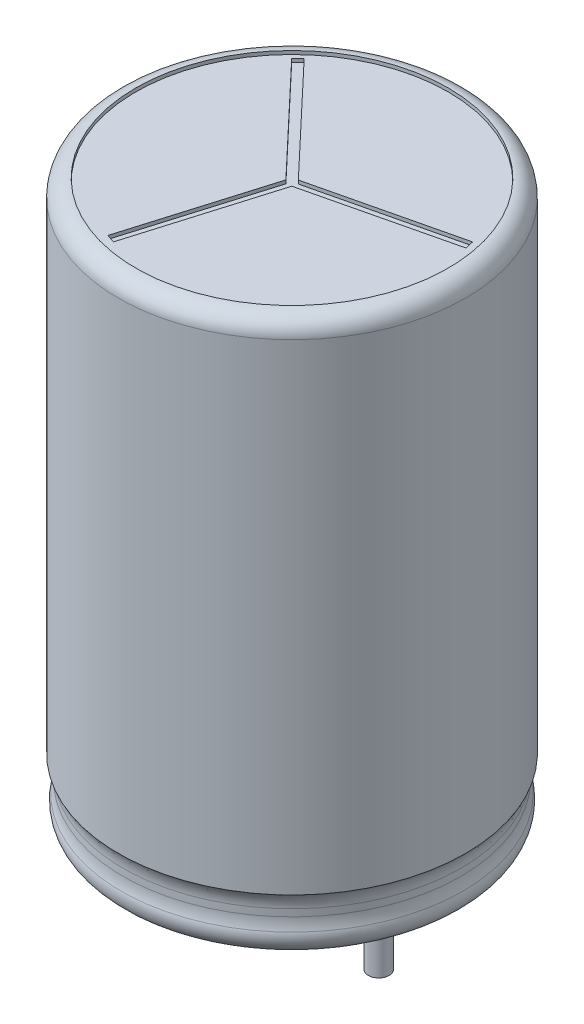
from build123d import *

# Parameters (mm, degrees)
SKETCH2_R          = 4.5
CUT_EXTRUDE1_DEPTH = 0.1
CUT_EXTRUDE2_DEPTH = 0.1
SKETCH4_W          = 0.3
SKETCH4_H          = 2.5
FILLET1_R          = 0.5


with BuildPart() as part:
    # Sketch1 → Revolve1 (revolve)
    with BuildSketch(Plane.XY):
        with BuildLine():
            Line((5, 16), (0, 16))
            Line((0, 16), (0, 0))
            Line((0, 0), (4.827244523, 0))
            ThreePointArc((4.827244523, 0), (4.990681342, 0.249416346), (4.961933008, 0.546222076))
            ThreePointArc((4.961933008, 0.546222076), (4.887026856, 0.767683511), (4.861659937, 1.00008966))
            Line((4.861659937, 1.00008966), (4.861659937, 1.202915685))
            ThreePointArc((4.861659937, 1.202915685), (4.896669937, 1.431894531), (4.99850097, 1.639950899))
            ThreePointArc((4.99850097, 1.639950899), (4.999616482, 1.64223006), (5, 1.644738417))
            Line((5, 1.644738417), (5, 16))
        make_face()
    revolve(axis=Axis((0, 16, 0), (0, -1, 0)))

    # Sketch2 → Cut-Extrude1 (cut)
    with BuildSketch(Plane(origin=(0, 16, 0), x_dir=(-1, 0, 0), z_dir=(0, 1, 0))):
        with Locations(Location((0, 0, 0), (0, 0, 270))):
            Circle(SKETCH2_R)
    extrude(amount=-CUT_EXTRUDE1_DEPTH, mode=Mode.SUBTRACT)

    # Sketch3 → Cut-Extrude2 (cut)
    with BuildSketch(Plane(origin=(0, 15.9, 0), x_dir=(-1, 0, 0), z_dir=(0, 1, 0))):
        Polygon((2.906036622, -3.256093686), (3.090537324, -3.081521376), (0.142645036, 0.03402539), (1.320649975, 3.989641976), (1.07721557, 4.062138116), (-0.10078937, 0.10652153), (-4.155587963, -0.860677244), (-4.096654259, -1.107745693), (-0.041855666, -0.14054692), align=None)
    extrude(amount=-CUT_EXTRUDE2_DEPTH, mode=Mode.SUBTRACT)

    # Sketch4 → Revolve2 (revolve)
    with BuildSketch(Plane(origin=(0, 0, 0), x_dir=(-1, 0, 0), z_dir=(0, 0, -1)), mode=Mode.PRIVATE) as revolve2_sk:
        with Locations((-2.65, -1.25)):
            Rectangle(SKETCH4_W, SKETCH4_H)
    revolve2 = revolve(revolve2_sk.sketch.rotate(Axis((2.5, -2.5, 0), (0, 1, 0)), 270), axis=Axis((2.5, -2.5, 0), (0, 1, 0)))

    # Fillet1
    fillet1_edges = [part.edges().sort_by_distance(p)[0] for p in [
        (-5, 16, 0),
        (-4.827244523, 0, 0),
    ]]
    fillet(fillet1_edges, radius=FILLET1_R - 0.0001)  # a hair under: the kernel refuses the full size

    # Simetría3: Revolve2 across plane
    add(revolve2.mirror(Plane(origin=(0, 0, 0), x_dir=(0, 0, 1), z_dir=(1, 0, 0))))


solid = part.part
